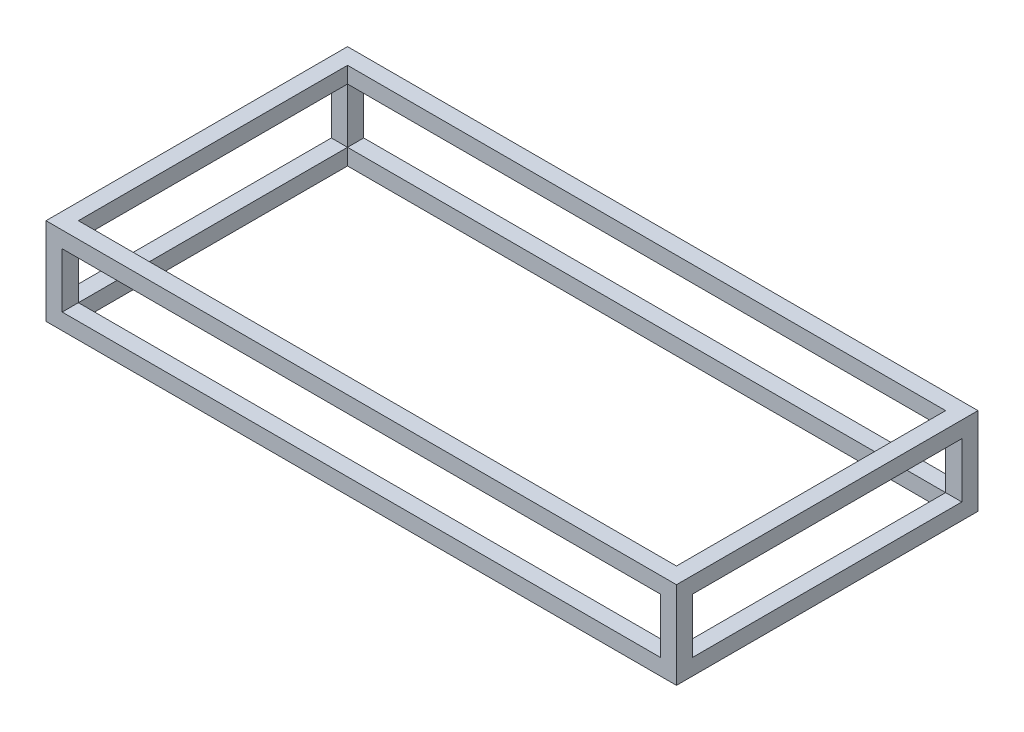
from build123d import *

# Parameters (mm, degrees)
SKETCH3_W           = 584.2
SKETCH3_H           = 279.4
SKETCH3_W_2         = 554.2
SKETCH3_H_2         = 249.4
BOSS_EXTRUDE3_DEPTH = 15
SKETCH4_W           = 15
SKETCH4_H           = 15
BOSS_EXTRUDE4_DEPTH = 50.8
SKETCH5_W           = 584.2
SKETCH5_H           = 279.4
SKETCH5_W_2         = 554.2
SKETCH5_H_2         = 249.4
BOSS_EXTRUDE6_DEPTH = 15


with BuildPart() as part:
    # Sketch3 → Boss-Extrude3 (new body)
    with BuildSketch(Plane(origin=(0, 0, 0), x_dir=(1, 0, 0), z_dir=(0, 1, 0))):
        Rectangle(SKETCH3_W, SKETCH3_H)
        Rectangle(SKETCH3_W_2, SKETCH3_H_2, mode=Mode.SUBTRACT)
    extrude(amount=BOSS_EXTRUDE3_DEPTH)

    # Sketch4 → Boss-Extrude4 (add)
    with BuildSketch(Plane(origin=(0, 15, 0), x_dir=(1, 0, 0), z_dir=(0, 1, 0))):
        with Locations((-284.6, 132.2)):
            Rectangle(SKETCH4_W, SKETCH4_H)
        with Locations((-284.6, -132.2)):
            Rectangle(SKETCH4_W, SKETCH4_H)
        with Locations((284.6, -132.2)):
            Rectangle(SKETCH4_W, SKETCH4_H)
        with Locations((284.6, 132.2)):
            Rectangle(SKETCH4_W, SKETCH4_H)
    extrude(amount=BOSS_EXTRUDE4_DEPTH)

    # Sketch5 → Boss-Extrude6 (add)
    with BuildSketch(Plane(origin=(0, 65.8, 0), x_dir=(1, 0, 0), z_dir=(0, 1, 0))):
        Rectangle(SKETCH5_W, SKETCH5_H)
        Rectangle(SKETCH5_W_2, SKETCH5_H_2, mode=Mode.SUBTRACT)
    extrude(amount=BOSS_EXTRUDE6_DEPTH)


solid = part.part
